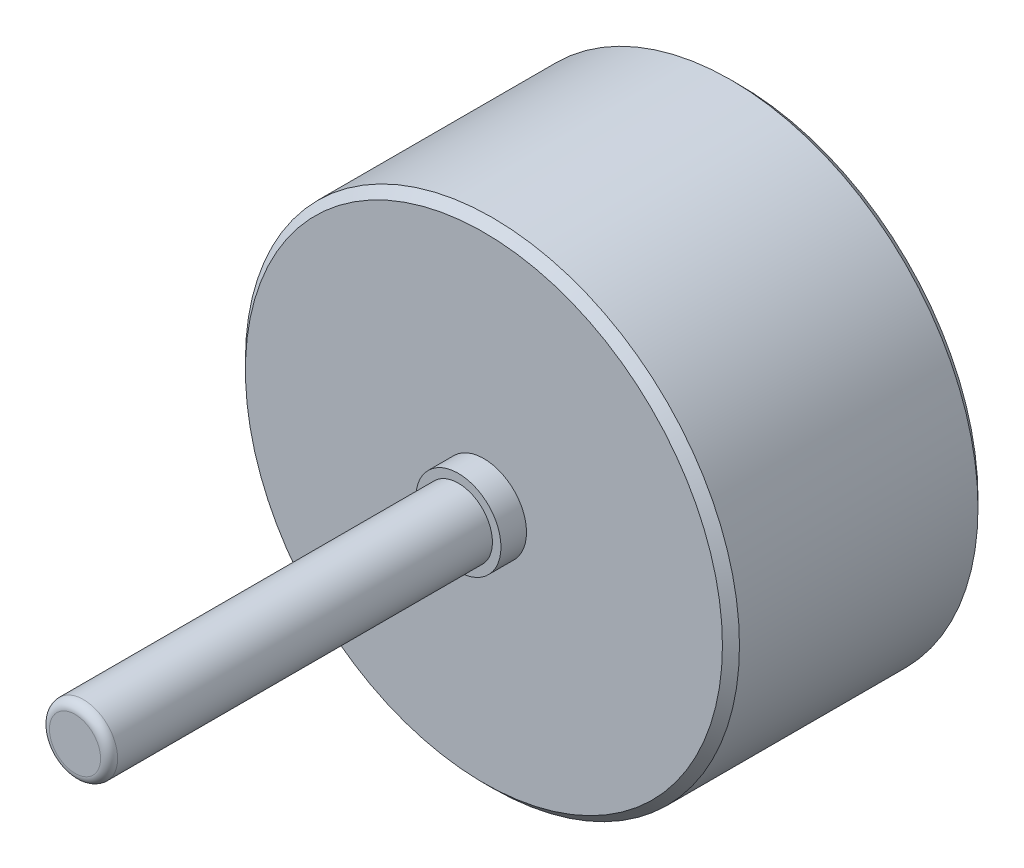
from build123d import *

# Parameters (mm, degrees)
ESQUISSE1_R             = 29
BOSS_EXTRU_1_DEPTH      = 30
ESQUISSE2_R             = 4
BOSS_EXTRU_2_DEPTH      = 10
ESQUISSE3_R             = 5
BOSS_EXTRU_3_DEPTH      = 3
ESQUISSE4_R             = 4
ENL_V_MAT_EXTRU_1_DEPTH = 5
CHANFREIN1_SIZE         = 1
ESQUISSE8_R             = 4
BOSS_EXTRU_4_DEPTH      = 38
CONG_1_R                = 1


with BuildPart() as part:
    # Esquisse1 → Boss.-Extru.1 (new body)
    with BuildSketch(Plane.XY):
        Circle(ESQUISSE1_R)
    extrude(amount=BOSS_EXTRU_1_DEPTH)

    # Esquisse2 → Boss.-Extru.2 (add)
    with BuildSketch(Plane.XY.offset(30)):
        Circle(ESQUISSE2_R)
    extrude(amount=BOSS_EXTRU_2_DEPTH)

    # Esquisse3 → Boss.-Extru.3 (add)
    with BuildSketch(Plane.XY.offset(30)):
        Circle(ESQUISSE3_R)
    extrude(amount=BOSS_EXTRU_3_DEPTH)

    # Esquisse4 → Enlèv. mat.-Extru.1 (cut)
    with BuildSketch(Plane(origin=(0, 0, 0), x_dir=(-1, 0, 0), z_dir=(0, 0, -1))):
        Circle(ESQUISSE4_R)
    extrude(amount=-ENL_V_MAT_EXTRU_1_DEPTH, mode=Mode.SUBTRACT)

    # Chanfrein1
    chanfrein1_edges = [part.edges().sort_by_distance(p)[0] for p in [
        (-29, 0, 30),
        (-29, 0, 0),
    ]]
    chamfer(chanfrein1_edges, length=CHANFREIN1_SIZE)

    # Esquisse8 → Boss.-Extru.4 (add)
    with BuildSketch(Plane.XY.offset(40)):
        Circle(ESQUISSE8_R)
    extrude(amount=BOSS_EXTRU_4_DEPTH)

    # Congé1
    cong_1_edges = [part.edges().sort_by_distance(p)[0] for p in [
        (-4, 0, 78),
    ]]
    fillet(cong_1_edges, radius=CONG_1_R)


solid = part.part
